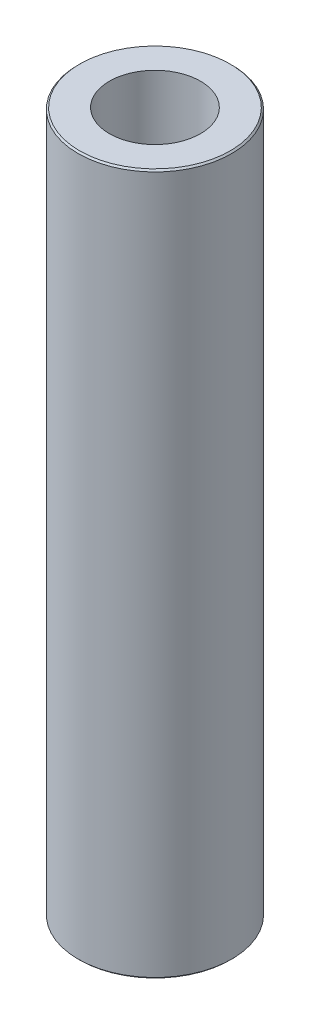
from build123d import *

# Parameters (mm, degrees)
SKETCH1_R           = 15
BOSS_EXTRUDE1_DEPTH = 136.844788614
SKETCH2_R           = 8.893687779
CUT_EXTRUDE1_DEPTH  = 139.479226495
CHAMFER1_SIZE       = 0.306499064


with BuildPart() as part:
    # Sketch1 → Boss-Extrude1 (new body)
    with BuildSketch(Plane(origin=(0, 0, 0), x_dir=(1, 0, 0), z_dir=(0, 1, 0))):
        Circle(SKETCH1_R)
    extrude(amount=BOSS_EXTRUDE1_DEPTH)

    # Sketch2 → Cut-Extrude1 (cut, through all)
    with BuildSketch(Plane(origin=(0, 0, 0), x_dir=(1, 0, 0), z_dir=(0, 1, 0))):
        Circle(SKETCH2_R)
    extrude(amount=CUT_EXTRUDE1_DEPTH, mode=Mode.SUBTRACT)

    # Chamfer1
    chamfer1_edges = [part.edges().sort_by_distance(p)[0] for p in [
        (-15, 136.844788614, 0),
        (-15, 0, 0),
    ]]
    chamfer(chamfer1_edges, length=CHAMFER1_SIZE)


solid = part.part
